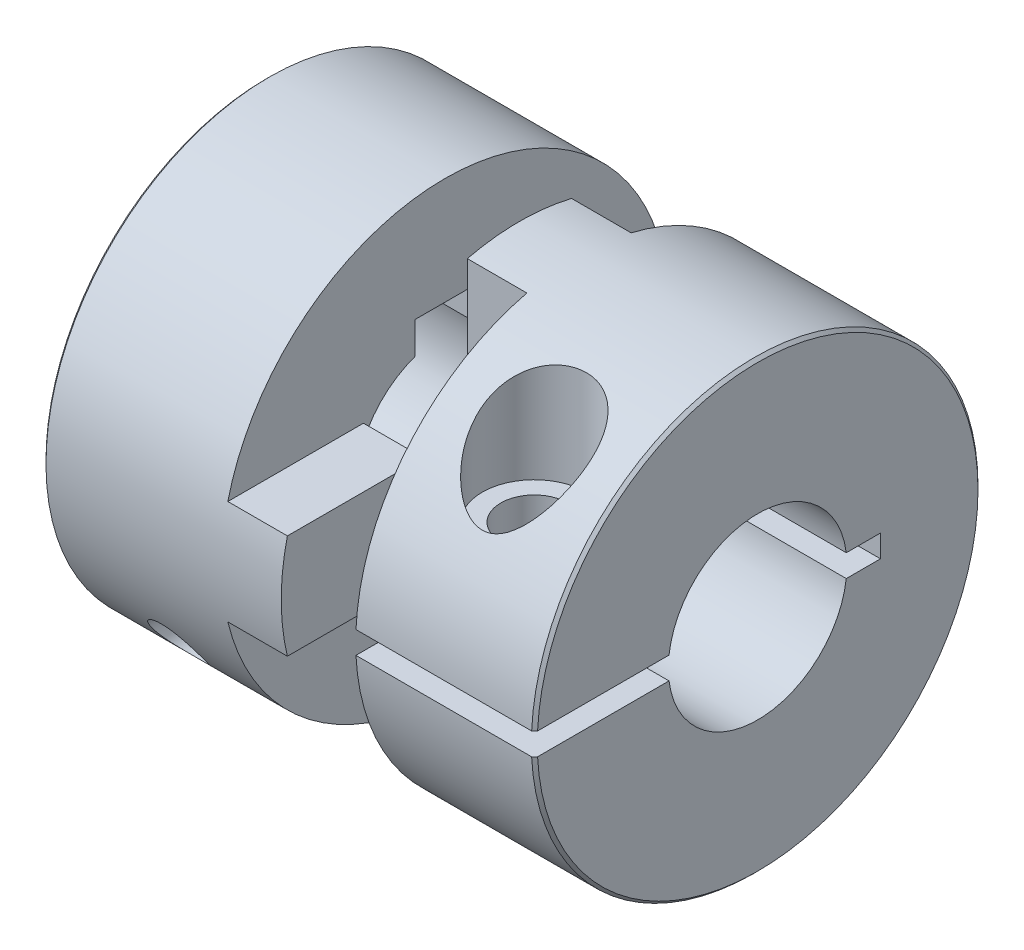
from build123d import *
from build123d.topology import SkipClean

# Parameters (mm, degrees)
SKETCH1_W                          = 12
SKETCH1_H                          = 15
BOSS_EXTRUDE1_DEPTH                = 4
BOSS_EXTRUDE2_START                = 4
BOSS_EXTRUDE2_DEPTH                = 4
SKETCH4_R                          = 6
CUT_EXTRUDE1_DEPTH                 = 16
CUT_EXTRUDE2_START                 = -16
SKETCH5_R                          = 6
CUT_EXTRUDE2_DEPTH                 = 16
CUT_EXTRUDE3_DEPTH                 = 12
CUT_EXTRUDE4_START                 = -12
CUT_EXTRUDE4_DEPTH                 = 12
SOCKET_HEAD_CAP_SCREW1_D           = 4.5
SOCKET_HEAD_CAP_SCREW1_DEPTH       = 14.25
SOCKET_HEAD_CAP_SCREW1_CBORE_D     = 7
SOCKET_HEAD_CAP_SCREW1_CBORE_DEPTH = 8
TAP1_D                             = 3.242
SOCKET_HEAD_CAP_SCREW2_D           = 4.5
SOCKET_HEAD_CAP_SCREW2_DEPTH       = 14.25
SOCKET_HEAD_CAP_SCREW2_CBORE_D     = 7
SOCKET_HEAD_CAP_SCREW2_CBORE_DEPTH = 8
TAP2_D                             = 3.242
CHAMFER1_SIZE                      = 0.2
CHAMFER2_SIZE                      = 0.2
DELETEFACE1_DEPTH                  = 12
CUT_EXTRUDE5_REACH                 = 41.23
SKETCH16_W                         = 4
SKETCH16_H                         = 7.8


# Read off the part's stored shape, not the designer's step: DeleteFace1
with BuildPart() as part:
    # Sketch1 → Revolve1 (revolve)
    with BuildSketch(Plane.XY, mode=Mode.PRIVATE) as revolve1_sk:
        with Locations((6, 7.5)):
            Rectangle(SKETCH1_W, SKETCH1_H)
        with Locations((27, 7.5)):
            Rectangle(SKETCH1_W, SKETCH1_H)
    revolve(revolve1_sk.sketch.rotate(Axis((0, 0, 0), (1, 0, 0)), 90), axis=Axis((0, 0, 0), (1, 0, 0)))

    # Sketch2 → Boss-Extrude1 (add)
    with SkipClean():  # the faces are left unmerged after this step: merging them gives an invalid solid
        with BuildSketch(Plane(origin=(12, 0, 0), x_dir=(0, 0, -1), z_dir=(1, 0, 0))):
            with BuildLine():
                Line((-14.585952146, 3.5), (-5.477225575, 3.5))
                ThreePointArc((-5.477225575, 3.5), (-6.5, 0), (-5.477225575, -3.5))
                Line((-5.477225575, -3.5), (-14.585952146, -3.5))
                ThreePointArc((-14.585952146, -3.5), (-15, 0), (-14.585952146, 3.5))
            make_face()
            with BuildLine():
                Line((5.477225575, 3.5), (14.585952146, 3.5))
                ThreePointArc((14.585952146, 3.5), (15, 0), (14.585952146, -3.5))
                Line((14.585952146, -3.5), (5.477225575, -3.5))
                ThreePointArc((5.477225575, -3.5), (6.5, 0), (5.477225575, 3.5))
            make_face()
        extrude(amount=BOSS_EXTRUDE1_DEPTH)

    # Sketch3 → Boss-Extrude2 (add)
    with SkipClean():  # the faces are left unmerged after this step: merging them gives an invalid solid
        with BuildSketch(Plane.ZY.offset(-21).offset(BOSS_EXTRUDE2_START)):
            with BuildLine():
                Line((-3.5, 14.585952146), (-3.5, 5.477225575))
                ThreePointArc((-3.5, 5.477225575), (0, 6.5), (3.5, 5.477225575))
                Line((3.5, 5.477225575), (3.5, 14.585952146))
                ThreePointArc((3.5, 14.585952146), (0, 15), (-3.5, 14.585952146))
            make_face()
            with BuildLine():
                Line((3.5, -5.477225575), (3.5, -14.585952146))
                ThreePointArc((3.5, -14.585952146), (0, -15), (-3.5, -14.585952146))
                Line((-3.5, -14.585952146), (-3.5, -5.477225575))
                ThreePointArc((-3.5, -5.477225575), (0, -6.5), (3.5, -5.477225575))
            make_face()
        extrude(amount=-BOSS_EXTRUDE2_DEPTH)

    # Sketch4 → Cut-Extrude1 (cut)
    with SkipClean():  # the faces are left unmerged after this step: merging them gives an invalid solid
        with BuildSketch(Plane(origin=(0, 0, 0), x_dir=(0, 0, -1), z_dir=(1, 0, 0))):
            with Locations(Location((0, 0, 0), (0, 0, 180))):
                Circle(SKETCH4_R)
        extrude(amount=CUT_EXTRUDE1_DEPTH, mode=Mode.SUBTRACT)

    # Sketch5 → Cut-Extrude2 (cut)
    with SkipClean():  # the faces are left unmerged after this step: merging them gives an invalid solid
        with BuildSketch(Plane(origin=(33, 0, 0), x_dir=(0, 0, -1), z_dir=(1, 0, 0)).offset(CUT_EXTRUDE2_START)):
            Circle(SKETCH5_R)
        extrude(amount=CUT_EXTRUDE2_DEPTH, mode=Mode.SUBTRACT)

    # Sketch6 → Cut-Extrude3 (cut)
    with SkipClean():  # the faces are left unmerged after this step: merging them gives an invalid solid
        with BuildSketch(Plane(origin=(0, 0, 0), x_dir=(0, 0, -1), z_dir=(1, 0, 0))):
            with BuildLine():
                Line((0.75, -14.981238267), (0.75, 8.25))
                Line((0.75, 8.25), (-0.75, 8.25))
                Line((-0.75, 8.25), (-0.75, -14.981238267))
                ThreePointArc((-0.75, -14.981238267), (0, -15), (0.75, -14.981238267))
            make_face()
        extrude(amount=CUT_EXTRUDE3_DEPTH, mode=Mode.SUBTRACT)

    # Sketch7 → Cut-Extrude4 (cut)
    with SkipClean():  # the faces are left unmerged after this step: merging them gives an invalid solid
        with BuildSketch(Plane(origin=(33, 0, 0), x_dir=(0, 0, -1), z_dir=(1, 0, 0)).offset(CUT_EXTRUDE4_START)):
            with BuildLine():
                Line((-14.981238267, 0.75), (8.25, 0.75))
                Line((8.25, 0.75), (8.25, -0.75))
                Line((8.25, -0.75), (-14.981238267, -0.75))
                ThreePointArc((-14.981238267, -0.75), (-15, 0), (-14.981238267, 0.75))
            make_face()
        extrude(amount=CUT_EXTRUDE4_DEPTH, mode=Mode.SUBTRACT)

    # Socket Head Cap Screw1
    with Locations(Plane(origin=(0, 0, -15), x_dir=(1, 0, 0), z_dir=(0, 0, -1))):
        with Locations((6, 9)):
            CounterBoreHole(SOCKET_HEAD_CAP_SCREW1_D / 2, SOCKET_HEAD_CAP_SCREW1_CBORE_D / 2, SOCKET_HEAD_CAP_SCREW1_CBORE_DEPTH, depth=SOCKET_HEAD_CAP_SCREW1_DEPTH)

    # Tap1 (through all)
    with Locations(Plane(origin=(0, 0, 0.75), x_dir=(-1, 0, 0), z_dir=(0, 0, -1))):
        with Locations((-6, -9)):
            Hole(TAP1_D / 2)

    # Socket Head Cap Screw2
    with Locations(Plane(origin=(0, 15, 0), x_dir=(1, 0, 0), z_dir=(0, 1, 0))):
        with Locations((27, -9)):
            CounterBoreHole(SOCKET_HEAD_CAP_SCREW2_D / 2, SOCKET_HEAD_CAP_SCREW2_CBORE_D / 2, SOCKET_HEAD_CAP_SCREW2_CBORE_DEPTH, depth=SOCKET_HEAD_CAP_SCREW2_DEPTH)

    # Tap2 (through all)
    with Locations(Plane(origin=(0, -0.75, 0), x_dir=(1, 0, 0), z_dir=(0, 1, 0))):
        with Locations((27, -9)):
            Hole(TAP2_D / 2)

    # Chamfer1
    chamfer1_edges = [part.edges().sort_by_distance(p)[0] for p in [
        (0, 10.86853256, -10.338036564),
    ]]
    chamfer(chamfer1_edges, length=CHAMFER1_SIZE)

    # Chamfer2
    chamfer2_edges = [part.edges().sort_by_distance(p)[0] for p in [
        (33, 0, -15),
    ]]
    chamfer(chamfer2_edges, length=CHAMFER2_SIZE)

    # DeleteFace1 outline → DeleteFace1 (add)
    with SkipClean():  # the faces are left unmerged after this step: merging them gives an invalid solid
        with BuildSketch(Plane.YZ):
            with BuildLine():
                Line((8.25, 0.75), (5.95294045, 0.75))
                ThreePointArc((5.95294045, 0.75), (6, 0), (5.95294045, -0.75))
                Line((5.95294045, -0.75), (8.25, -0.75))
                Line((8.25, -0.75), (8.25, 0.75))
            make_face()
        extrude(amount=DELETEFACE1_DEPTH)

    # Sketch16 → Cut-Extrude5 (cut, up to next)
    with BuildSketch(Plane(origin=(0, 0, 0), x_dir=(0, 0, -1), z_dir=(1, 0, 0)), mode=Mode.PRIVATE) as cut_extrude5_sk1:
        with Locations((0, 3.9)):
            Rectangle(SKETCH16_W, SKETCH16_H)
    cut_extrude5_tool1 = extrude(cut_extrude5_sk1.sketch, amount=CUT_EXTRUDE5_REACH, mode=Mode.PRIVATE) & part.part
    add(cut_extrude5_tool1.solids().sort_by_distance((0, 3.9, 0))[0], mode=Mode.SUBTRACT)


solid = part.part
